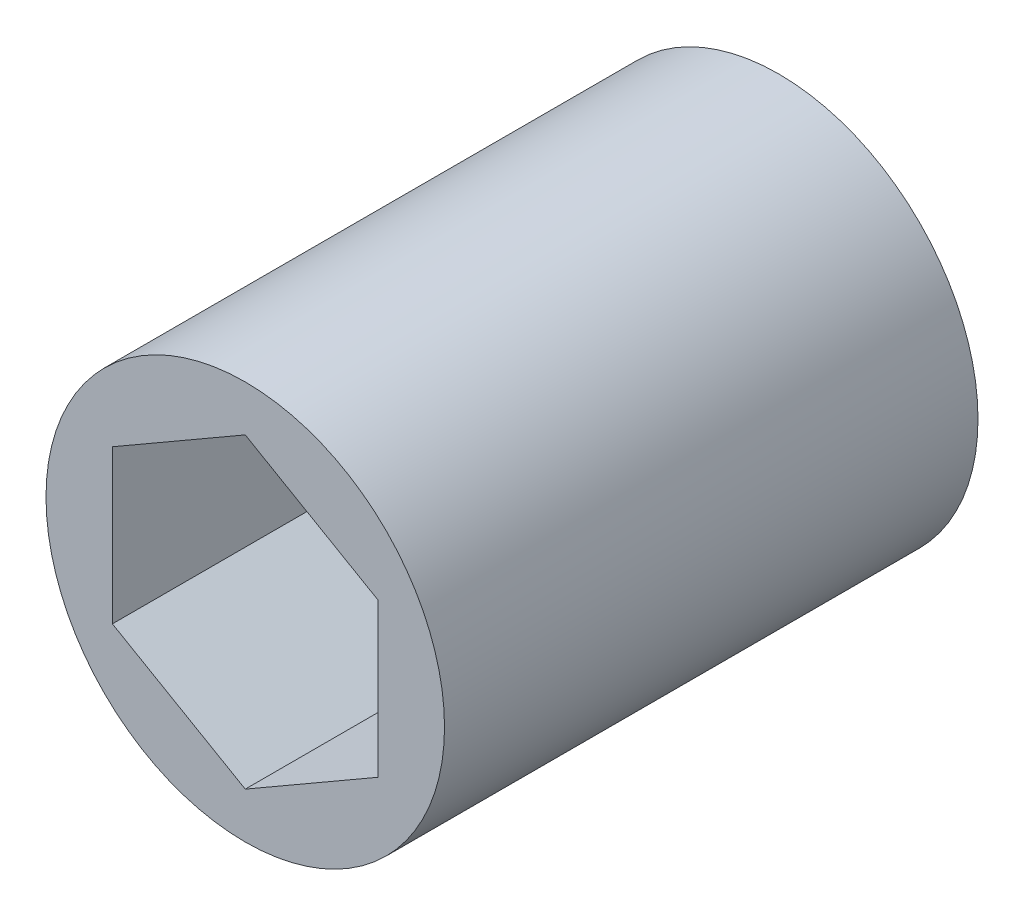
from build123d import *

# Parameters (mm, degrees)
SKETCH1_R           = 9.525
BOSS_EXTRUDE1_DEPTH = 25.5016


with BuildPart() as part:
    # Sketch1 → Boss-Extrude1 (new body)
    with BuildSketch(Plane.XY):
        Circle(SKETCH1_R)
        Polygon((0, 7.332348419), (-6.35, 3.666174209), (-6.35, -3.666174209), (0, -7.332348419), (6.35, -3.666174209), (6.35, 3.666174209), align=None, mode=Mode.SUBTRACT)
    extrude(amount=BOSS_EXTRUDE1_DEPTH)


solid = part.part
